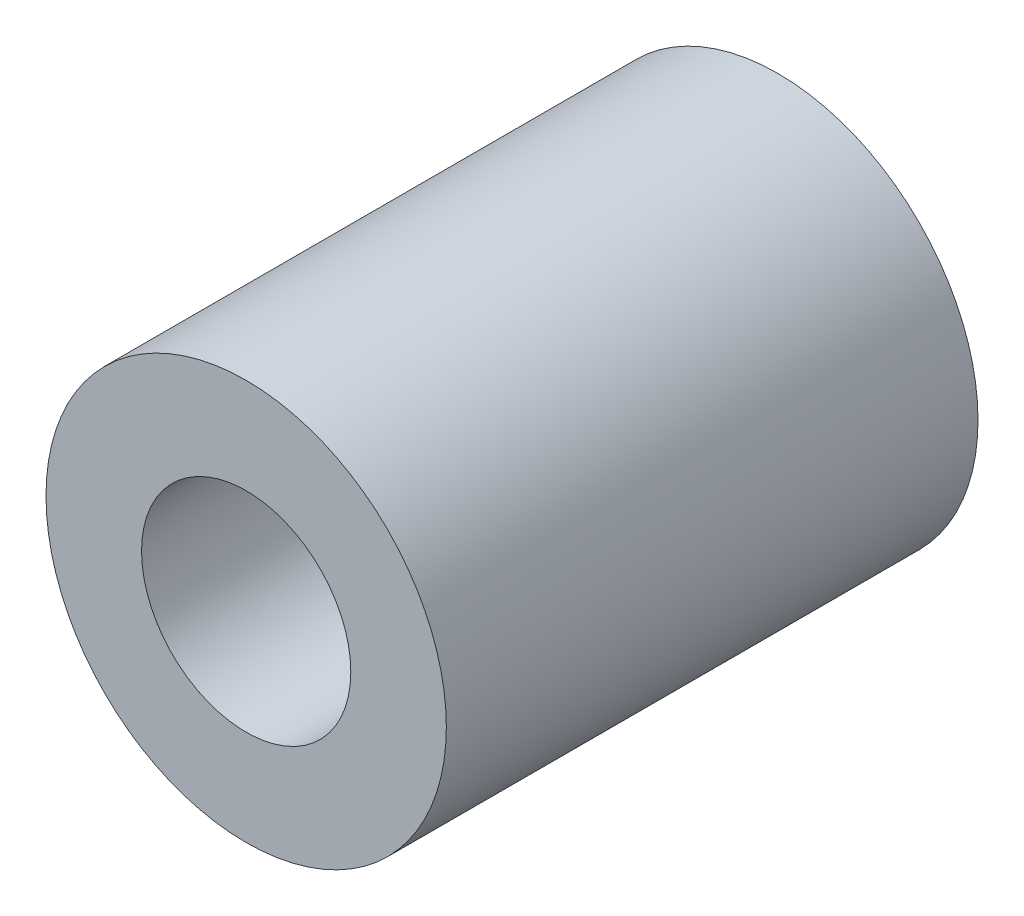
from build123d import *

# Parameters (mm, degrees)
SKETCH1_R           = 4.7625
SKETCH1_R_2         = 2.4892
BOSS_EXTRUDE1_DEPTH = 6.3246


with BuildPart() as part:
    # Sketch1 → Boss-Extrude1 (new, symmetric)
    with BuildSketch(Plane.XY):
        Circle(SKETCH1_R)
        Circle(SKETCH1_R_2, mode=Mode.SUBTRACT)
    extrude(amount=BOSS_EXTRUDE1_DEPTH, both=True)


solid = part.part
